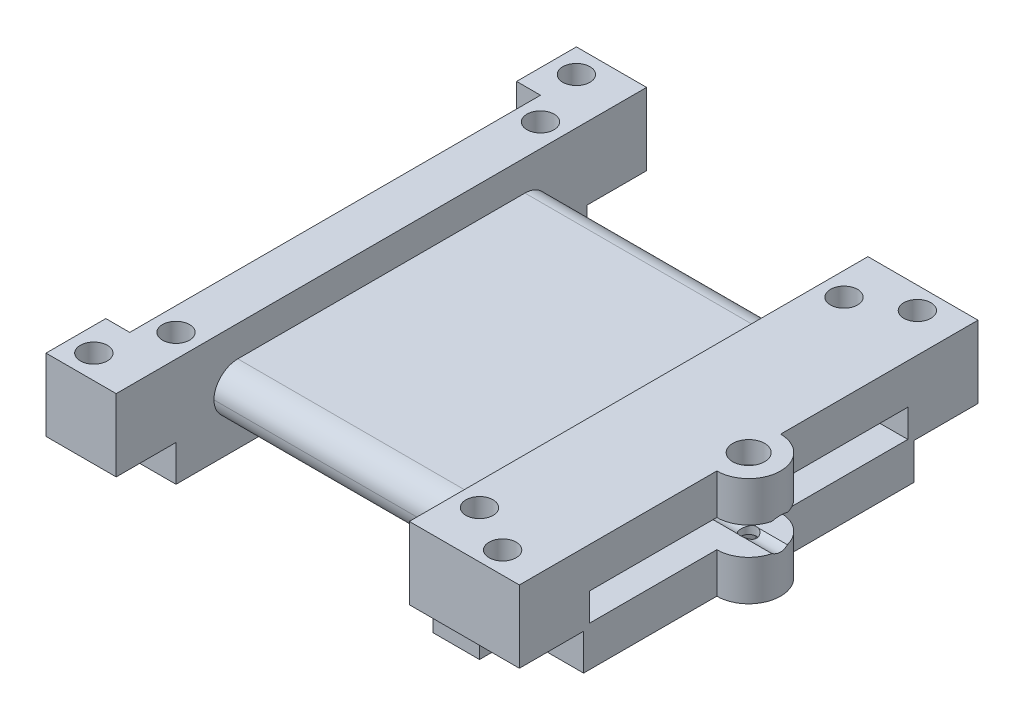
from build123d import *

# Parameters (mm, degrees)
SKETCH1_W              = 42
SKETCH1_H              = 5.9
SKETCH1_W_2            = 39.9
SKETCH1_H_2            = 3.5
BOSS_EXTRUDE1_DEPTH    = 32.25
FILLET2_R              = 3
SKETCH2_W              = 51.5
SKETCH2_H              = 13.6
SKETCH2_W_2            = 39.9
SKETCH2_H_2            = 3.5
BOSS_EXTRUDE2_DEPTH    = 5.8
SKETCH3_W              = 51.5
SKETCH3_H              = 13.6
SKETCH3_W_2            = 39.9
SKETCH3_H_2            = 3.5
BOSS_EXTRUDE3_DEPTH    = 5.8
SKETCH4_R              = 1.7
CUT_EXTRUDE1_DEPTH     = 62.792596644
SKETCH8_W              = 8.8
SKETCH8_H              = 7.5
BOSS_EXTRUDE4_DEPTH    = 13.6
CUT_EXTRUDE4_DEPTH     = 4
SKETCH15_W             = 39.9
SKETCH15_H             = 3.5
CUT_EXTRUDE5_DEPTH     = 79.468767672
SKETCH17_R             = 2
CUT_EXTRUDE6_DEPTH     = 79.468767672
M3_CLEARANCE_HOLE1_D   = 3.4
CUT_EXTRUDE8_START     = -13.6
CUT_EXTRUDE8_OUTLINE_W = 8.8
CUT_EXTRUDE8_OUTLINE_H = 7.5
CUT_EXTRUDE8_OUTLINE_R = 1.7
CUT_EXTRUDE8_DEPTH     = 4.55


# Read off the part's stored shape, not the designer's step: Cut-Extrude8
with BuildPart() as part:
    # Sketch1 → Boss-Extrude1 (new body)
    with BuildSketch(Plane(origin=(0, 0, 0), x_dir=(0, 0, -1), z_dir=(1, 0, 0))):
        with Locations((21, 2.95)):
            Rectangle(SKETCH1_W, SKETCH1_H)
        with Locations((21, 2.95)):
            Rectangle(SKETCH1_W_2, SKETCH1_H_2, mode=Mode.SUBTRACT)
    extrude(amount=BOSS_EXTRUDE1_DEPTH)

    # Fillet2
    # the kernel refuses this fillet: 3 mm, written as the material it takes off along each edge
    with BuildSketch(Plane(origin=(-7.5, 0, -42), x_dir=(0, 0, 1), z_dir=(1, 0, 0)), Plane(origin=(-7.5, 5.9, 0), x_dir=(0, 0, -1), z_dir=(1, 0, 0)), Plane(origin=(-7.5, 5.9, -42), x_dir=(0, -1, 0), z_dir=(1, 0, 0))) as fillet2_piece_1:
        with BuildLine():
            CenterArc((FILLET2_R, -FILLET2_R), FILLET2_R, 90, 90)
            Line((0, -FILLET2_R), (0, 0))
            Line((0, 0), (FILLET2_R, 0))
        make_face()
    extrude(amount=47.25, mode=Mode.SUBTRACT)
    with BuildSketch(Plane(origin=(-7.5, 0, 0), x_dir=(0, 0, -1), z_dir=(1, 0, 0))) as fillet2_piece_2:
        with BuildLine():
            CenterArc((FILLET2_R, FILLET2_R), FILLET2_R, 180, 90)
            Line((0, FILLET2_R), (0, 0))
            Line((0, 0), (FILLET2_R, 0))
        make_face()
    extrude(amount=47.25, mode=Mode.SUBTRACT)

    # Sketch2 → Boss-Extrude2 (add)
    with BuildSketch(Plane(origin=(32.25, 0, 0), x_dir=(0, 0, -1), z_dir=(1, 0, 0))):
        with Locations((21, 2.95)):
            Rectangle(SKETCH2_W, SKETCH2_H)
        with Locations((21, 2.95)):
            Rectangle(SKETCH2_W_2, SKETCH2_H_2, mode=Mode.SUBTRACT)
    extrude(amount=BOSS_EXTRUDE2_DEPTH)

    # Sketch3 → Boss-Extrude3 (add)
    with BuildSketch(Plane.ZY):
        with Locations((-21, 2.95)):
            Rectangle(SKETCH3_W, SKETCH3_H)
        with Locations((-21, 2.95)):
            Rectangle(SKETCH3_W_2, SKETCH3_H_2, mode=Mode.SUBTRACT)
    extrude(amount=BOSS_EXTRUDE3_DEPTH)

    # Sketch4 → Cut-Extrude1 (cut, through all)
    with BuildSketch(Plane(origin=(0, 9.75, 0), x_dir=(1, 0, 0), z_dir=(0, 1, 0))):
        with Locations(Location((-2.9, 43.85, 0), (0, 0, 270))):
            Circle(SKETCH4_R)
        with Locations(Location((35.15, 43.85, 0), (0, 0, 270))):
            Circle(SKETCH4_R)
        with Locations(Location((-2.9, -1.85, 0), (0, 0, 270))):
            Circle(SKETCH4_R)
        with Locations(Location((35.15, -1.85, 0), (0, 0, 270))):
            Circle(SKETCH4_R)
    extrude(amount=-CUT_EXTRUDE1_DEPTH, mode=Mode.SUBTRACT)

    # Sketch8 → Boss-Extrude4 (add)
    with BuildSketch(Plane(origin=(0, 9.75, 0), x_dir=(1, 0, 0), z_dir=(0, 1, 0))):
        with Locations((-4.4, 50.5)):
            Rectangle(SKETCH8_W, SKETCH8_H)
        with Locations((-4.4, -8.5)):
            Rectangle(SKETCH8_W, SKETCH8_H)
        with BuildLine():
            Line((46.05, 25), (46.05, 49.75))
            Line((46.05, 49.75), (32.25, 49.75))
            Line((32.25, 49.75), (32.25, 46.75))
            Line((32.25, 46.75), (38.05, 46.75))
            Line((38.05, 46.75), (38.05, -4.75))
            Line((38.05, -4.75), (32.25, -4.75))
            Line((32.25, -4.75), (32.25, -7.75))
            Line((32.25, -7.75), (46.05, -7.75))
            Line((46.05, -7.75), (46.05, 17))
            ThreePointArc((46.05, 17), (50.05, 21), (46.05, 25))
        make_face()
    extrude(amount=-BOSS_EXTRUDE4_DEPTH)

    # Sketch13 → CSK for M2 Flat Head Machine Screw1 (revolve, cut)
    with BuildSketch(Plane(origin=(46.05, 9.75, -21), x_dir=(0, 0, 1), z_dir=(1, 0, 0))):
        Polygon((0, 0), (0, 13.6), (1, 13.6), (1, 3.75), (2, 2.75), (2, 0), align=None)
    revolve(axis=Axis((46.05, 16.1, -21), (0, -1, 0)), mode=Mode.SUBTRACT)

    # Sketch14 → Cut-Extrude4 (cut)
    with BuildSketch(Plane.XZ.offset(3.85)):
        Polygon((43.625128869, -21), (44.837564435, -23.1), (47.262435565, -23.1), (48.474871131, -21), (47.262435565, -18.9), (44.837564435, -18.9), align=None)
    extrude(amount=-CUT_EXTRUDE4_DEPTH, mode=Mode.SUBTRACT)

    # Sketch15 → Cut-Extrude5 (cut, through all)
    with BuildSketch(Plane.ZY.offset(5.8)):
        with Locations((-21, 2.95)):
            Rectangle(SKETCH15_W, SKETCH15_H)
    extrude(amount=-CUT_EXTRUDE5_DEPTH, mode=Mode.SUBTRACT)

    # Sketch17 → Cut-Extrude6 (cut, through all)
    with BuildSketch(Plane.ZY.offset(5.8)):
        with Locations((-21, 2.95)):
            Circle(SKETCH17_R)
    extrude(amount=-CUT_EXTRUDE6_DEPTH, mode=Mode.SUBTRACT)

    # M3 Clearance Hole1 (through all)
    with Locations(Plane(origin=(-5.8, 9.75, -51.25), x_dir=(0, 0, 1), z_dir=(0, 1, 0))):
        with Locations((0, 0), (4.25, 47), (56.25, 47), (60.5, 0)):
            Hole(M3_CLEARANCE_HOLE1_D / 2)

    # Cut-Extrude8 outline → Cut-Extrude8 (cut)
    # profile 1 of 4: a face of its own
    with BuildSketch(Plane(origin=(0, 9.75, 0), x_dir=(1, 0, 0), z_dir=(0, 1, 0)).offset(CUT_EXTRUDE8_START)):
        with Locations((-4.4, 50.5)):
            Rectangle(CUT_EXTRUDE8_OUTLINE_W, CUT_EXTRUDE8_OUTLINE_H)
        with Locations((-5.8, 51.25)):
            Circle(CUT_EXTRUDE8_OUTLINE_R, mode=Mode.SUBTRACT)
    # profile 2 of 4: a face of its own
    with BuildSketch(Plane(origin=(0, 9.75, 0), x_dir=(1, 0, 0), z_dir=(0, 1, 0)).offset(CUT_EXTRUDE8_START)):
        with Locations((-4.4, -8.5)):
            Rectangle(CUT_EXTRUDE8_OUTLINE_W, CUT_EXTRUDE8_OUTLINE_H)
        with Locations((-5.8, -9.25)):
            Circle(CUT_EXTRUDE8_OUTLINE_R, mode=Mode.SUBTRACT)
    # profile 3 of 4: a face of its own
    with BuildSketch(Plane(origin=(0, 9.75, 0), x_dir=(1, 0, 0), z_dir=(0, 1, 0)).offset(CUT_EXTRUDE8_START)):
        Polygon((32.25, 49.75), (32.25, 46.75), (38.05, 46.75), (38.05, 41.7), (46.05, 41.7), (46.05, 49.75), align=None)
        with Locations((41.2, 47)):
            Circle(CUT_EXTRUDE8_OUTLINE_R, mode=Mode.SUBTRACT)
    # profile 4 of 4: a face of its own
    with BuildSketch(Plane(origin=(0, 9.75, 0), x_dir=(1, 0, 0), z_dir=(0, 1, 0)).offset(CUT_EXTRUDE8_START)):
        Polygon((38.05, -4.75), (32.25, -4.75), (32.25, -7.75), (46.05, -7.75), (46.05, 0.3), (38.05, 0.3), align=None)
        with Locations((41.2, -5)):
            Circle(CUT_EXTRUDE8_OUTLINE_R, mode=Mode.SUBTRACT)
    extrude(amount=CUT_EXTRUDE8_DEPTH, mode=Mode.SUBTRACT)


solid = part.part
